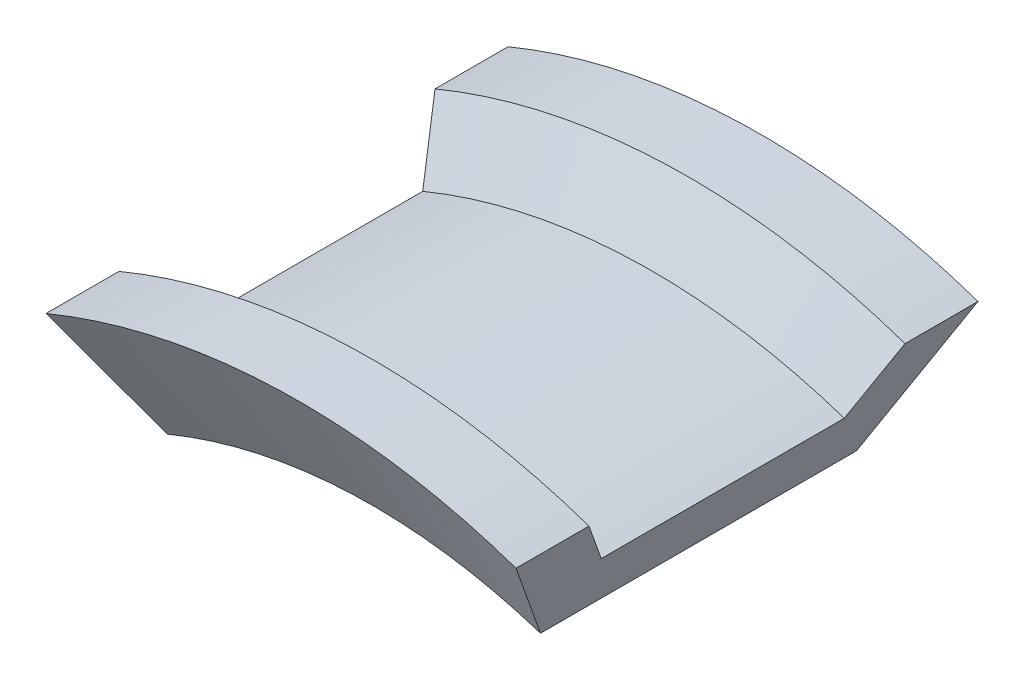
from build123d import *

# Parameters (mm, degrees)
SKETCH5_W           = 90
SKETCH5_H           = 70
CUT_EXTRUDE1_DEPTH  = 81.467778105
SKETCH4_R           = 3
BOSS_EXTRUDE3_DEPTH = 3.2
SKETCH6_R           = 5.25
CUT_EXTRUDE2_DEPTH  = 1.75


with BuildPart() as part:
    # Sweep1: sweep along a path in Sketch3
    with BuildLine(Plane.XY) as sweep1_path:
        ThreePointArc((-32.880465325, -13.619534675), (3.47446075, -6.388090263), (39.829386824, -13.619534675))
    # Sketch2 → Sweep1 (sweep)
    with BuildSketch(Plane(origin=(-32.880465325, -13.619534675, 0), x_dir=(-0.3826834323650842, 0.9238795325112891, 0), z_dir=(0.9238795325112891, 0.3826834323650842, 0))):
        Polygon((0, 19.226497308), (0, -19.226497308), (10, -25), (10, -36.547005384), (-10, -25), (-10, 25), (10, 36.547005384), (10, 25), align=None)
    sweep(path=sweep1_path.line)

    # Sketch5 → Cut-Extrude1 (cut, through all)
    with BuildSketch(Plane(origin=(32.880465325, -13.619534675, 0), x_dir=(0, 0, -1), z_dir=(0.9238795325112837, -0.3826834323650971, 0))):
        Rectangle(SKETCH5_W, SKETCH5_H)
    extrude(amount=CUT_EXTRUDE1_DEPTH, mode=Mode.SUBTRACT)


with BuildPart() as body_2:
    # Sketch4 → Boss-Extrude3 (new body)
    with BuildSketch(Plane(origin=(0, 0, 3.2), x_dir=(0, 0, -1), z_dir=(1, 0, 0))):
        with BuildLine():
            Line((9.478517871, -28.682323793), (12.772747817, -16.388090263))
            Line((12.772747817, -16.388090263), (-6.372747817, -16.388090263))
            Line((-6.372747817, -16.388090263), (-3.078517871, -28.682323793))
            ThreePointArc((-3.078517871, -28.682323793), (3.2, -33.5), (9.478517871, -28.682323793))
        make_face()
        with Locations((3.2, -27)):
            Circle(SKETCH4_R, mode=Mode.SUBTRACT)
    extrude(amount=BOSS_EXTRUDE3_DEPTH)


with BuildPart() as body_3:
    # Body-Move/Copy1: copy of body 2
    add(body_2.part.moved(Location((6.4, 0, 0))))

    # Sketch6 → Cut-Extrude2 (cut)
    with BuildSketch(Plane(origin=(9.6, 0, 0), x_dir=(0, 0, -1), z_dir=(1, 0, 0))):
        with Locations((0, -27)):
            Circle(SKETCH6_R)
    extrude(amount=-CUT_EXTRUDE2_DEPTH, mode=Mode.SUBTRACT)


with BuildPart() as body_4:
    # Body-Move/Copy2: copy of body 2
    add(body_2.part.moved(Location((-6.4, 0, 0))))


solid = Compound([part.part, body_2.part, body_3.part, body_4.part])
